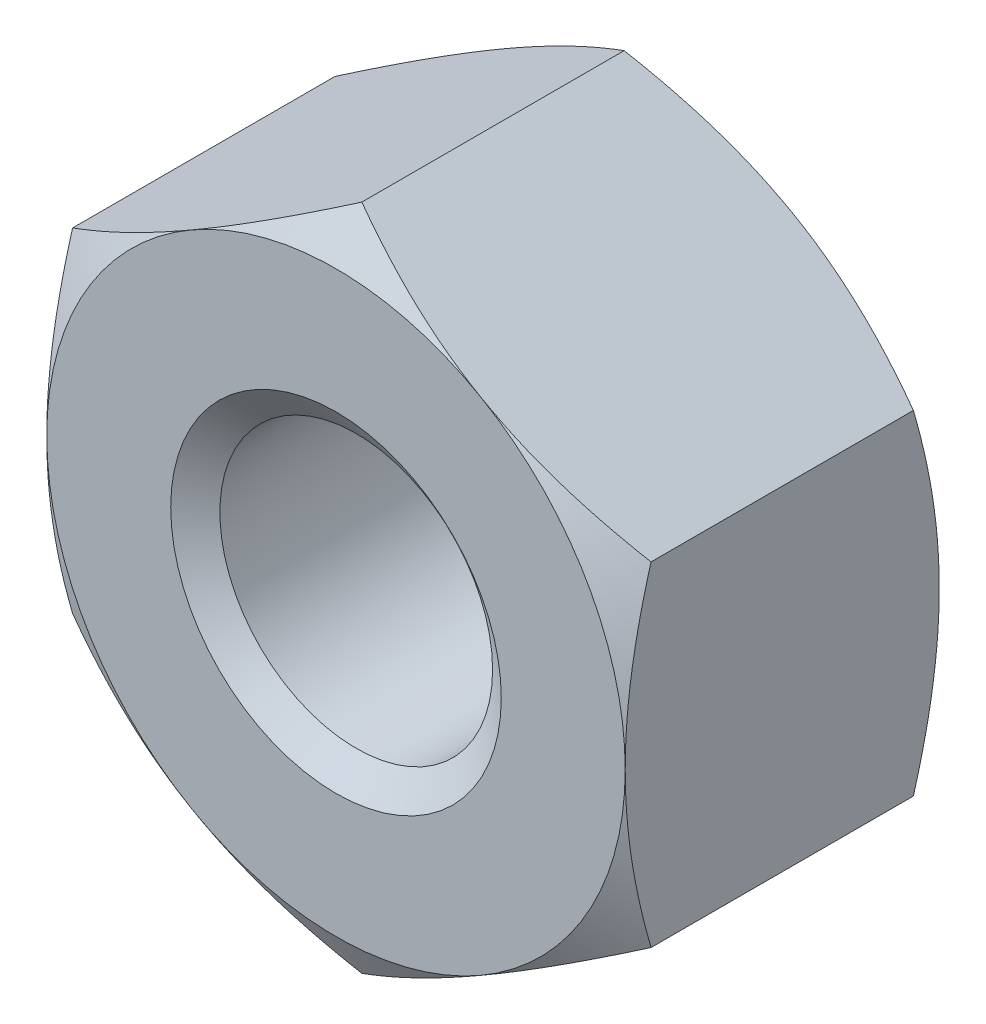
from build123d import *

# Parameters (mm, degrees)
BASENUT_START = -3.8
BASENUTSKE_R  = 1.65
BASENUT_DEPTH = 3.8


# Read off the part's stored shape, not the designer's step: ThreadSchematic
with BuildPart() as part:
    # BaseNutSke → BaseNut (new body)
    with BuildSketch(Plane.XY.offset(BASENUT_START)):
        Polygon((3.5, 2.020725942), (3.5, -2.020725942), (0, -4.041451884), (-3.5, -2.020725942), (-3.5, 2.020725942), (0, 4.041451884), align=None)
        Circle(BASENUTSKE_R, mode=Mode.SUBTRACT)
    extrude(amount=BASENUT_DEPTH)

    # Sketch5 (on Front Plane) → EndChamfer (revolve, cut)
    with BuildSketch(Plane.XY):
        Polygon((3.7746, 2), (3.505020098, 1.615), (3.8254, 1.615), (3.8254, 2), align=None)
    revolve(axis=Axis((3.7746, 2, 0), (-0.5735764363510482, -0.8191520442889905, 0)), mode=Mode.SUBTRACT)

    # Sketch3 → Double-Chamfer (revolve, cut)
    with BuildSketch(Plane(origin=(0, 0, 0), x_dir=(0, 0, -1), z_dir=(1, 0, 0))):
        Polygon((3.8, 3.5), (3.487392609, 4.041451884), (3.487392609, 14.041451884), (13.8, 14.041451884), (13.8, 3.5), align=None)
        Polygon((0.312607391, 14.041451884), (-10, 14.041451884), (-10, 3.5), (0, 3.5), (0.312607391, 4.041451884), align=None)
    revolve(axis=Axis((0, 0, 0), (0, 0, -1)), mode=Mode.SUBTRACT)

    # ThreadSchematic outline → ThreadSchematic (revolve, cut)
    with BuildSketch(Plane.XZ):
        Polygon((1.65, 0), (1.65, -0.245072638), (2, 0), align=None)
        Polygon((2, -3.7746), (1.65, -3.529527362), (1.65, -3.8), (2, -3.8), align=None)
    revolve(axis=Axis((0, 0, 0), (0, 0, 1)), mode=Mode.SUBTRACT)


solid = part.part
